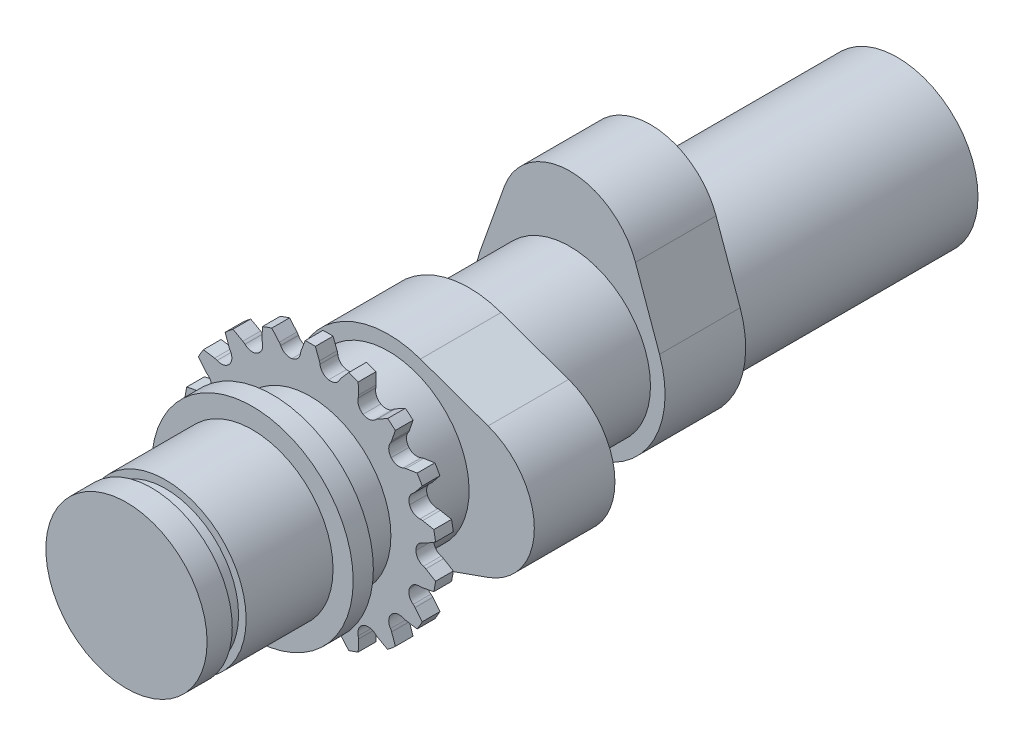
from build123d import *

# Parameters (mm, degrees)
BOSS_EXTRUDE2_DEPTH      = 12.7
BOSS_EXTRUDE3_DEPTH      = 63.5
BOSS_EXTRUDE3_DEPTH_BACK = 51.59375
SKETCH3_R                = 12.7
CRVPATTERN3_START        = 28.575
CRVPATTERN3_OUTLINE_R    = 12.7
CRVPATTERN3_DEPTH        = 12.7
BOSS_EXTRUDE5_START      = -25.4
BOSS_EXTRUDE5_DEPTH      = 2.794
BOSS_EXTRUDE7_START      = -13.49375
SKETCH10_R               = 15.875
BOSS_EXTRUDE7_DEPTH      = 3.175
SKETCH11_R               = 12.7
BOSS_EXTRUDE8_DEPTH      = 6.35
CUT_EXTRUDE1_START       = -6.15315
SKETCH12_R               = 12.7
SKETCH12_R_2             = 11.5062
CUT_EXTRUDE1_DEPTH       = 2.1844


# Read off the part's stored shape, not the designer's step: CrvPattern3
with BuildPart() as part:
    # Sketch2 → Boss-Extrude2 (new body)
    with BuildSketch(Plane.XY):
        with BuildLine():
            Line((14.12854649, 5.034399247), (10.332705095, 15.687054901))
            ThreePointArc((10.332705095, 15.687054901), (0, 22.9743), (-10.332705095, 15.687054901))
            Line((-10.332705095, 15.687054901), (-14.12854649, 5.034399247))
            ThreePointArc((-14.12854649, 5.034399247), (0, -14.9987), (14.12854649, 5.034399247))
        make_face()
    extrude(amount=BOSS_EXTRUDE2_DEPTH)

    # Sketch3 → Boss-Extrude3 (add, two sides: drawn at the far end of the back side and taken through both)
    with BuildSketch(Plane.XY.offset(12.7).offset(-BOSS_EXTRUDE3_DEPTH_BACK)):
        Circle(SKETCH3_R)
    extrude(amount=BOSS_EXTRUDE3_DEPTH + BOSS_EXTRUDE3_DEPTH_BACK)

    # CrvPattern3 outline → CrvPattern3 (add)
    with BuildSketch(Plane.XY.offset(CRVPATTERN3_START)):
        with BuildLine():
            ThreePointArc((5.034399247, 14.12854649), (-14.9987, 0), (5.034399247, -14.12854649))
            Line((5.034399247, -14.12854649), (15.687054901, -10.332705095))
            ThreePointArc((15.687054901, -10.332705095), (22.9743, 0), (15.687054901, 10.332705095))
            Line((15.687054901, 10.332705095), (5.034399247, 14.12854649))
        make_face()
        Circle(CRVPATTERN3_OUTLINE_R, mode=Mode.SUBTRACT)
    extrude(amount=CRVPATTERN3_DEPTH)

    # Sketch7 → Boss-Extrude5 (add)
    with BuildSketch(Plane.XY.offset(76.2).offset(BOSS_EXTRUDE5_START)):
        with BuildLine():
            Line((-0.79375, 19.897774396), (-1.436590898, 18.231487888))
            ThreePointArc((-1.436590898, 18.231487888), (-1.498138247, 18.03477884), (-1.533681014, 17.831753627))
            ThreePointArc((-1.533681014, 17.831753627), (-1.969599997, 16.882094075), (-2.888368056, 16.384355312))
            ThreePointArc((-2.888368056, 16.384355312), (-3.922431543, 16.537748425), (-4.657630199, 17.280917099))
            ThreePointArc((-4.657630199, 17.280917099), (-4.760468189, 17.459542051), (-4.885582235, 17.623337659))
            Line((-4.885582235, 17.623337659), (-6.059558633, 18.969270258))
            ThreePointArc((-6.059558633, 18.969270258), (-6.810852326, 18.712662973), (-7.551320668, 18.426313281))
            Line((-7.551320668, 18.426313281), (-7.585489966, 16.640651609))
            ThreePointArc((-7.585489966, 16.640651609), (-7.576047099, 16.434755136), (-7.540007663, 16.231817498))
            ThreePointArc((-7.540007663, 16.231817498), (-7.624834818, 15.190336353), (-8.3179577, 14.408377726))
            ThreePointArc((-8.3179577, 14.408377726), (-9.342178022, 14.198393618), (-10.287162472, 14.64574693))
            ThreePointArc((-10.287162472, 14.64574693), (-10.444891903, 14.778426816), (-10.618482046, 14.889552815))
            Line((-10.618482046, 14.889552815), (-12.181995065, 15.752792171))
            ThreePointArc((-12.181995065, 15.752792171), (-12.800215344, 15.254702622), (-13.398090619, 14.732366841))
            Line((-13.398090619, 14.732366841), (-12.819466994, 13.042707157))
            ThreePointArc((-12.819466994, 13.042707157), (-12.74017286, 12.852457411), (-12.636898109, 12.674084624))
            ThreePointArc((-12.636898109, 12.674084624), (-12.36040203, 11.666399881), (-12.744278886, 10.694537142))
            ThreePointArc((-12.744278886, 10.694537142), (-13.63491237, 10.146912643), (-14.675911128, 10.244083533))
            ThreePointArc((-14.675911128, 10.244083533), (-14.869507504, 10.3148152), (-15.070636211, 10.359868156))
            Line((-15.070636211, 10.359868156), (-16.835103105, 10.636294862))
            ThreePointArc((-16.835103105, 10.636294862), (-17.245683481, 9.9568), (-17.628853105, 9.261479534))
            Line((-17.628853105, 9.261479534), (-16.507227108, 7.871619731))
            ThreePointArc((-16.507227108, 7.871619731), (-16.36764575, 7.71996364), (-16.209592142, 7.587670094))
            ThreePointArc((-16.209592142, 7.587670094), (-15.605122337, 6.735323405), (-15.633451952, 5.690777544))
            ThreePointArc((-15.633451952, 5.690777544), (-16.283326029, 4.871948852), (-17.294528308, 4.606832476))
            ThreePointArc((-17.294528308, 4.606832476), (-17.500641049, 4.60708464), (-17.705049229, 4.580630502))
            Line((-17.705049229, 4.580630502), (-19.457649251, 4.236903417))
            ThreePointArc((-19.457649251, 4.236903417), (-19.61106767, 3.457960351), (-19.733315733, 2.673521109))
            Line((-19.733315733, 2.673521109), (-18.203972012, 1.751098794))
            ThreePointArc((-18.203972012, 1.751098794), (-18.020939002, 1.65632832), (-17.827170135, 1.586070568))
            ThreePointArc((-17.827170135, 1.586070568), (-16.967634583, 0.991867524), (-16.636999988, 0.000626187))
            ThreePointArc((-16.636999988, 0.000626187), (-16.967258577, -0.991366685), (-17.827170135, -1.586070568))
            ThreePointArc((-17.827170135, -1.586070568), (-18.020939002, -1.65632832), (-18.203972012, -1.751098794))
            Line((-18.203972012, -1.751098794), (-19.733315733, -2.673521109))
            ThreePointArc((-19.733315733, -2.673521109), (-19.61106767, -3.457960351), (-19.457649251, -4.236903417))
            Line((-19.457649251, -4.236903417), (-17.705049229, -4.580630502))
            ThreePointArc((-17.705049229, -4.580630502), (-17.500641049, -4.60708464), (-17.294528308, -4.606832476))
            ThreePointArc((-17.294528308, -4.606832476), (-16.283599682, -4.871222219), (-15.63388029, -5.689600697))
            ThreePointArc((-15.63388029, -5.689600697), (-15.605379777, -6.734590871), (-16.209592142, -7.587670094))
            ThreePointArc((-16.209592142, -7.587670094), (-16.36764575, -7.71996364), (-16.507227108, -7.871619731))
            Line((-16.507227108, -7.871619731), (-17.628853105, -9.261479534))
            ThreePointArc((-17.628853105, -9.261479534), (-17.245683481, -9.9568), (-16.835103105, -10.636294862))
            Line((-16.835103105, -10.636294862), (-15.070636211, -10.359868156))
            ThreePointArc((-15.070636211, -10.359868156), (-14.869507504, -10.3148152), (-14.675911128, -10.244083533))
            ThreePointArc((-14.675911128, -10.244083533), (-13.63552234, -10.14677067), (-12.745083897, -10.693577767))
            ThreePointArc((-12.745083897, -10.693577767), (-12.360894486, -11.665799573), (-12.636898109, -12.674084624))
            ThreePointArc((-12.636898109, -12.674084624), (-12.74017286, -12.852457411), (-12.819466994, -13.042707157))
            Line((-12.819466994, -13.042707157), (-13.398090619, -14.732366841))
            ThreePointArc((-13.398090619, -14.732366841), (-12.800215344, -15.254702622), (-12.181995065, -15.752792171))
            Line((-12.181995065, -15.752792171), (-10.618482046, -14.889552815))
            ThreePointArc((-10.618482046, -14.889552815), (-10.444891903, -14.778426816), (-10.287162472, -14.64574693))
            ThreePointArc((-10.287162472, -14.64574693), (-9.342799764, -14.198468829), (-8.319042288, -14.407751539))
            ThreePointArc((-8.319042288, -14.407751539), (-7.625502893, -15.189940678), (-7.540007663, -16.231817498))
            ThreePointArc((-7.540007663, -16.231817498), (-7.576047099, -16.434755136), (-7.585489966, -16.640651609))
            Line((-7.585489966, -16.640651609), (-7.551320668, -18.426313281))
            ThreePointArc((-7.551320668, -18.426313281), (-6.810852326, -18.712662973), (-6.059558633, -18.969270258))
            Line((-6.059558633, -18.969270258), (-4.885582235, -17.623337659))
            ThreePointArc((-4.885582235, -17.623337659), (-4.760468189, -17.459542051), (-4.657630199, -17.280917099))
            ThreePointArc((-4.657630199, -17.280917099), (-3.923197652, -16.537622099), (-2.889601404, -16.384137839))
            ThreePointArc((-2.889601404, -16.384137839), (-1.970363111, -16.881950758), (-1.533681014, -17.831753627))
            ThreePointArc((-1.533681014, -17.831753627), (-1.498138247, -18.03477884), (-1.436590898, -18.231487888))
            Line((-1.436590898, -18.231487888), (-0.79375, -19.897774396))
            ThreePointArc((-0.79375, -19.897774396), (0, -19.9136), (0.79375, -19.897774396))
            Line((0.79375, -19.897774396), (1.436590898, -18.231487888))
            ThreePointArc((1.436590898, -18.231487888), (1.498138247, -18.03477884), (1.533681014, -17.831753627))
            ThreePointArc((1.533681014, -17.831753627), (1.969599997, -16.882094075), (2.888368056, -16.384355312))
            ThreePointArc((2.888368056, -16.384355312), (3.922431543, -16.537748425), (4.657630199, -17.280917099))
            ThreePointArc((4.657630199, -17.280917099), (4.760468189, -17.459542051), (4.885582235, -17.623337659))
            Line((4.885582235, -17.623337659), (6.059558633, -18.969270258))
            ThreePointArc((6.059558633, -18.969270258), (6.810852326, -18.712662973), (7.551320668, -18.426313281))
            Line((7.551320668, -18.426313281), (7.585489966, -16.640651609))
            ThreePointArc((7.585489966, -16.640651609), (7.576047099, -16.434755136), (7.540007663, -16.231817498))
            ThreePointArc((7.540007663, -16.231817498), (7.624834818, -15.190336353), (8.3179577, -14.408377726))
            ThreePointArc((8.3179577, -14.408377726), (9.342123063, -14.198849561), (10.287162472, -14.64574693))
            ThreePointArc((10.287162472, -14.64574693), (10.444891903, -14.778426816), (10.618482046, -14.889552815))
            Line((10.618482046, -14.889552815), (12.181995065, -15.752792171))
            ThreePointArc((12.181995065, -15.752792171), (12.800215344, -15.254702622), (13.398090619, -14.732366841))
            Line((13.398090619, -14.732366841), (12.819466994, -13.042707157))
            ThreePointArc((12.819466994, -13.042707157), (12.74017286, -12.852457411), (12.636898109, -12.674084624))
            ThreePointArc((12.636898109, -12.674084624), (12.36040203, -11.666399881), (12.744278886, -10.694537142))
            ThreePointArc((12.744278886, -10.694537142), (13.63491237, -10.146912643), (14.675911128, -10.244083533))
            ThreePointArc((14.675911128, -10.244083533), (14.869507504, -10.3148152), (15.070636211, -10.359868156))
            Line((15.070636211, -10.359868156), (16.835103105, -10.636294862))
            ThreePointArc((16.835103105, -10.636294862), (17.245683481, -9.9568), (17.628853105, -9.261479534))
            Line((17.628853105, -9.261479534), (16.507227108, -7.871619731))
            ThreePointArc((16.507227108, -7.871619731), (16.36764575, -7.71996364), (16.209592142, -7.587670094))
            ThreePointArc((16.209592142, -7.587670094), (15.605122337, -6.735323405), (15.633451952, -5.690777544))
            ThreePointArc((15.633451952, -5.690777544), (16.283075056, -4.871564252), (17.294528308, -4.606832476))
            ThreePointArc((17.294528308, -4.606832476), (17.500641049, -4.60708464), (17.705049229, -4.580630502))
            Line((17.705049229, -4.580630502), (19.457649251, -4.236903417))
            ThreePointArc((19.457649251, -4.236903417), (19.61106767, -3.457960351), (19.733315733, -2.673521109))
            Line((19.733315733, -2.673521109), (18.203972012, -1.751098794))
            ThreePointArc((18.203972012, -1.751098794), (18.020939002, -1.65632832), (17.827170135, -1.586070568))
            ThreePointArc((17.827170135, -1.586070568), (16.967634583, -0.991867524), (16.636999988, -0.000626187))
            ThreePointArc((16.636999988, -0.000626187), (16.967625956, 0.991091117), (17.827170135, 1.586070568))
            ThreePointArc((17.827170135, 1.586070568), (18.020939002, 1.65632832), (18.203972012, 1.751098794))
            Line((18.203972012, 1.751098794), (19.733315733, 2.673521109))
            ThreePointArc((19.733315733, 2.673521109), (19.61106767, 3.457960351), (19.457649251, 4.236903417))
            Line((19.457649251, 4.236903417), (17.705049229, 4.580630502))
            ThreePointArc((17.705049229, 4.580630502), (17.500641049, 4.60708464), (17.294528308, 4.606832476))
            ThreePointArc((17.294528308, 4.606832476), (16.283599682, 4.871222219), (15.63388029, 5.689600697))
            ThreePointArc((15.63388029, 5.689600697), (15.604940304, 6.734724169), (16.209592142, 7.587670094))
            ThreePointArc((16.209592142, 7.587670094), (16.36764575, 7.71996364), (16.507227108, 7.871619731))
            Line((16.507227108, 7.871619731), (17.628853105, 9.261479534))
            ThreePointArc((17.628853105, 9.261479534), (17.245683481, 9.9568), (16.835103105, 10.636294862))
            Line((16.835103105, 10.636294862), (15.070636211, 10.359868156))
            ThreePointArc((15.070636211, 10.359868156), (14.869507504, 10.3148152), (14.675911128, 10.244083533))
            ThreePointArc((14.675911128, 10.244083533), (13.63552234, 10.14677067), (12.745083897, 10.693577767))
            ThreePointArc((12.745083897, 10.693577767), (12.360435926, 11.665774524), (12.636898109, 12.674084624))
            ThreePointArc((12.636898109, 12.674084624), (12.74017286, 12.852457411), (12.819466994, 13.042707157))
            Line((12.819466994, 13.042707157), (13.398090619, 14.732366841))
            ThreePointArc((13.398090619, 14.732366841), (12.800215344, 15.254702622), (12.181995065, 15.752792171))
            Line((12.181995065, 15.752792171), (10.618482046, 14.889552815))
            ThreePointArc((10.618482046, 14.889552815), (10.444891903, 14.778426816), (10.287162472, 14.64574693))
            ThreePointArc((10.287162472, 14.64574693), (9.342799764, 14.198468829), (8.319042288, 14.407751539))
            ThreePointArc((8.319042288, 14.407751539), (7.625080555, 15.189760303), (7.540007663, 16.231817498))
            ThreePointArc((7.540007663, 16.231817498), (7.576047099, 16.434755136), (7.585489966, 16.640651609))
            Line((7.585489966, 16.640651609), (7.551320668, 18.426313281))
            ThreePointArc((7.551320668, 18.426313281), (6.810852326, 18.712662973), (6.059558633, 18.969270258))
            Line((6.059558633, 18.969270258), (4.885582235, 17.623337659))
            ThreePointArc((4.885582235, 17.623337659), (4.760468189, 17.459542051), (4.657630199, 17.280917099))
            ThreePointArc((4.657630199, 17.280917099), (3.923197652, 16.537622099), (2.889601404, 16.384137839))
            ThreePointArc((2.889601404, 16.384137839), (1.970027934, 16.881636812), (1.533681014, 17.831753627))
            ThreePointArc((1.533681014, 17.831753627), (1.498138247, 18.03477884), (1.436590898, 18.231487888))
            Line((1.436590898, 18.231487888), (0.79375, 19.897774396))
            ThreePointArc((0.79375, 19.897774396), (0, 19.9136), (-0.79375, 19.897774396))
        make_face()
    extrude(amount=BOSS_EXTRUDE5_DEPTH)

    # Sketch10 → Boss-Extrude7 (add)
    with BuildSketch(Plane.XY.offset(76.2).offset(BOSS_EXTRUDE7_START)):
        Circle(SKETCH10_R)
    extrude(amount=-BOSS_EXTRUDE7_DEPTH)

    # Sketch11 → Boss-Extrude8 (add)
    with BuildSketch(Plane.XY.offset(76.2)):
        Circle(SKETCH11_R)
    extrude(amount=BOSS_EXTRUDE8_DEPTH)

    # Sketch12 → Cut-Extrude1 (cut)
    with BuildSketch(Plane.XY.offset(82.55).offset(CUT_EXTRUDE1_START)):
        Circle(SKETCH12_R)
        Circle(SKETCH12_R_2, mode=Mode.SUBTRACT)
    extrude(amount=CUT_EXTRUDE1_DEPTH, mode=Mode.SUBTRACT)


solid = part.part
